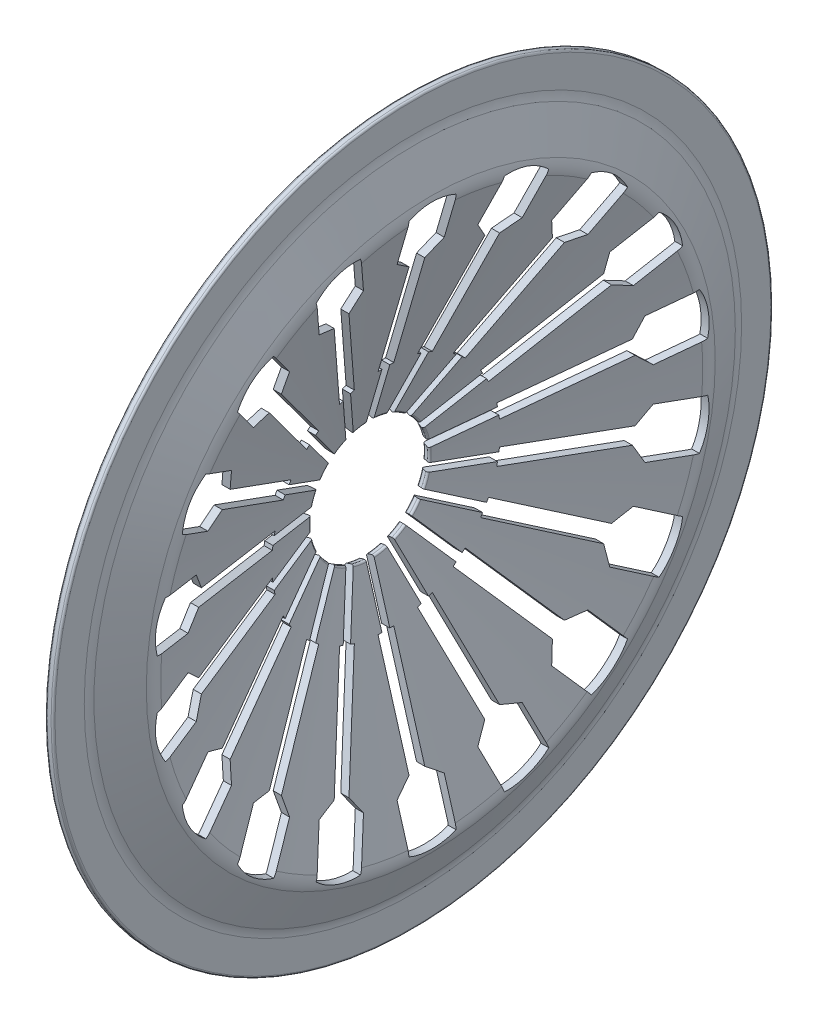
from build123d import *

# Parameters (mm, degrees)
THICKEN1_T1        = 2
FILLET1_R          = 0.5
CUT_EXTRUDE1_DEPTH = 131.378158524
CIRPATTERN1_COUNT  = 18


with BuildPart() as body_1:
    # Surface-Revolve1: a surface, the sketch's curves turned about an axis
    with BuildLine(Plane.XY, mode=Mode.PRIVATE) as surface_revolve1_1_path:
        Line((0, 15), (15.73581931, 68.889128899))
        ThreePointArc((15.73581931, 68.889128899), (15.92485798, 70.628009898), (15.503402747, 72.32560179))
        Line((15.503402747, 72.32560179), (11.402851472, 81.528543571))
        ThreePointArc((11.402851472, 81.528543571), (11.079409921, 82.523272064), (10.97, 83.563526206))
        Line((10.97, 83.563526206), (10.97, 91.5))
    surface_revolve1_1 = Shell.revolve(surface_revolve1_1_path.wire(), 360, Axis((0, 0, 0), (1, 0, 0)))
    add(Solid.thicken(surface_revolve1_1, THICKEN1_T1))

    # Fillet1
    fillet1_edges = [body_1.edges().sort_by_distance(p)[0] for p in [
        (0, -15, 0),
        (10.97, -91.5, 0),
        (8.97, -91.5, 0),
        (-1.919826036, -15.560596102, 0),
    ]]
    fillet(fillet1_edges, radius=FILLET1_R)

    # Sketch2 → Cut-Extrude1 (cut, symmetric)
    with BuildSketch(Plane(origin=(0, 0, 0), x_dir=(0, 0, -1), z_dir=(1, 0, 0))):
        with BuildLine():
            Line((-6, 69.979956509), (-6, 58.979956509))
            Line((-6, 58.979956509), (-2, 55.979956509))
            Line((-2, 55.979956509), (-2, 28.979956509))
            Line((-2, 28.979956509), (-1, 28.979956509))
            Line((-1, 28.979956509), (-1, 1.979956509))
            Line((-1, 1.979956509), (1, 1.979956509))
            Line((1, 1.979956509), (1, 28.979956509))
            Line((1, 28.979956509), (2, 28.979956509))
            Line((2, 28.979956509), (2, 55.979956509))
            Line((2, 55.979956509), (6, 58.979956509))
            Line((6, 58.979956509), (6, 69.979956509))
            ThreePointArc((6, 69.979956509), (0, 71.232229424), (-6, 69.979956509))
        make_face()
    cut_extrude1 = extrude(amount=CUT_EXTRUDE1_DEPTH, both=True, mode=Mode.SUBTRACT)

    # CirPattern1: Cut-Extrude1 ×18 about axis
    cirpattern1_axis = Axis((0, 0, 0), (1, 0, 0))
    for i in range(1, CIRPATTERN1_COUNT):
        add(cut_extrude1.rotate(cirpattern1_axis, i * 360 / CIRPATTERN1_COUNT), mode=Mode.SUBTRACT)


solid = body_1.part
